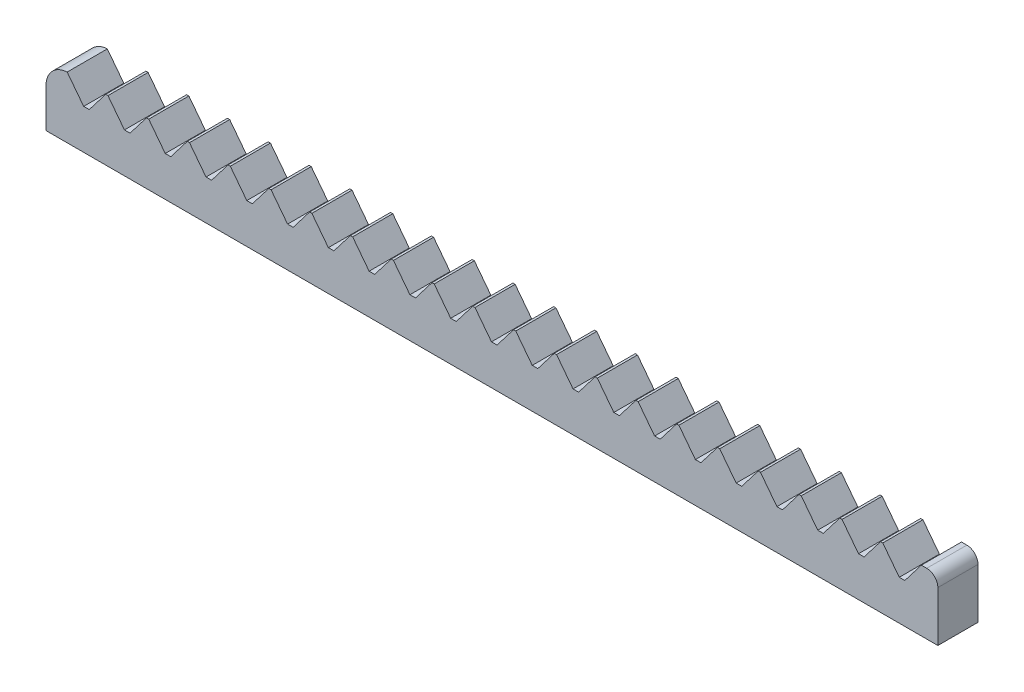
from build123d import *

# Parameters (mm, degrees)
SKIZZE1_W                       = 80
SKIZZE1_H                       = 5.5
KOERPER_DEPTH                   = 1.8
SCHNITT_LINEAR_AUSTRAGEN1_DEPTH = 50.553348274
LINEARES_MUSTER10_COUNT         = 21
LINEARES_MUSTER10_PITCH         = 3.658
VERRUNDUNG1_R                   = 2
VERRUNDUNG2_R                   = 1


with BuildPart() as part:
    # Skizze1 → Koerper (new, symmetric)
    with BuildSketch(Plane.XY):
        with Locations((9.115418405, 2.75)):
            Rectangle(SKIZZE1_W, SKIZZE1_H)
    extrude(amount=KOERPER_DEPTH, both=True)

    # kerbe → Schnitt-Linear austragen1 (cut, symmetric)
    with BuildSketch(Plane.XY.offset(1.8)):
        Polygon((-195.870933041, 5.5), (-29.084581595, 5.5), (-28.984581595, 5.5), (-27.505581595, 3.57116725), (-27.005581595, 3.57116725), (-25.526581595, 5.5), (-25.426581595, 5.5), (141.359769852, 5.5), (141.359769852, 339.072702894), (-195.870933041, 339.072702894), align=None)
    schnitt_linear_austragen1 = extrude(amount=SCHNITT_LINEAR_AUSTRAGEN1_DEPTH, both=True, mode=Mode.SUBTRACT)

    # Lineares Muster10: Schnitt-Linear austragen1 ×21
    with Locations(*[(i * LINEARES_MUSTER10_PITCH, 0, 0) for i in range(1, LINEARES_MUSTER10_COUNT)]):
        add(schnitt_linear_austragen1, mode=Mode.SUBTRACT)

    # Verrundung1
    # the kernel refuses this fillet: 2 mm, written as the material it takes off along each edge
    with BuildSketch(Plane(origin=(-30.884581595, 5.5, -6.793746089), x_dir=(1, 0, 0), z_dir=(0, 0, 1))) as verrundung1_piece_1:
        with BuildLine():
            CenterArc((2, -1.997498436), VERRUNDUNG1_R, 92.865983983, 87.134016017)
            Line((0, -1.997498436), (-0.04, -1.997498436))
            Line((-0.04, -1.997498436), (-0.04, 0))
            Line((-0.04, 0), (0, 0.04))
            ThreePointArc((0, 0.04), (0.95, 0.04), (1.898, 0.039949969))
            Line((1.898, 0.039949969), (1.9, 0))
        make_face()
    extrude(amount=13.587492178, mode=Mode.SUBTRACT)

    # Verrundung2
    verrundung2_edges = [part.edges().sort_by_distance(p)[0] for p in [
        (49.115418405, 5.5, 0),
    ]]
    fillet(verrundung2_edges, radius=VERRUNDUNG2_R)


solid = part.part
